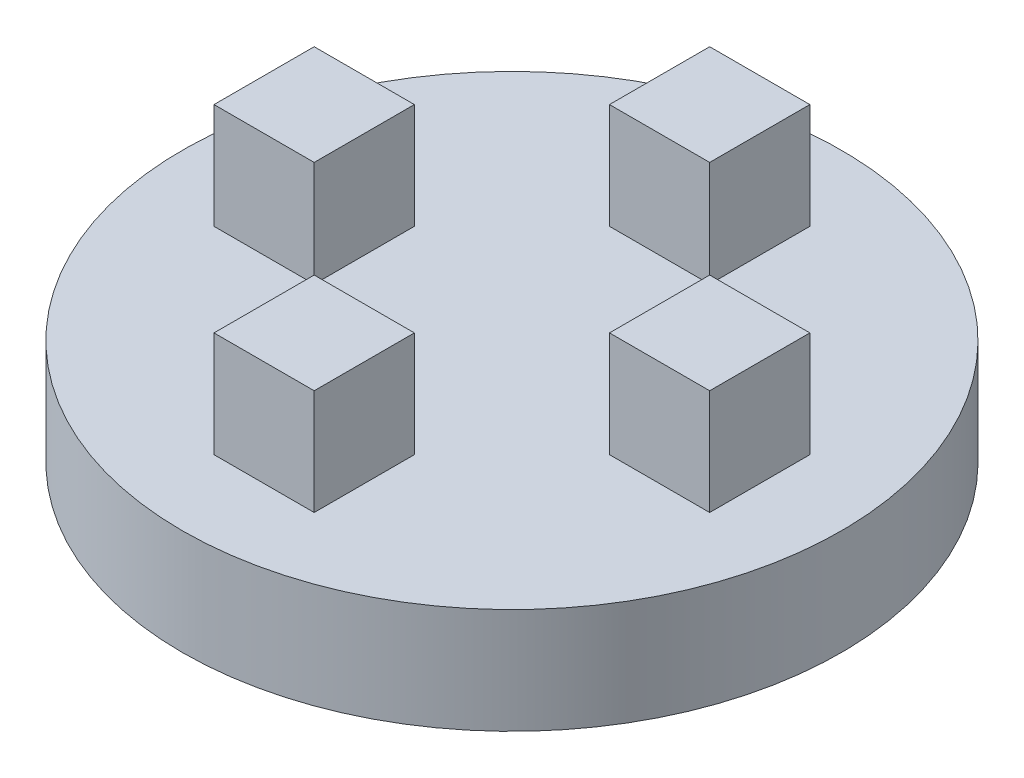
from build123d import *

# Parameters (mm, degrees)
SKETCH1_R           = 12.5
BOSS_EXTRUDE1_DEPTH = 2
SKETCH2_W           = 3.8
SKETCH2_H           = 3.8
BOSS_EXTRUDE3_DEPTH = 4
SKETCH3_R           = 3.5
BOSS_EXTRUDE4_DEPTH = 1
BOSS_EXTRUDE5_DEPTH = 5


with BuildPart() as part:
    # Sketch1 → Boss-Extrude1 (new, symmetric)
    with BuildSketch(Plane(origin=(0, 0, 0), x_dir=(1, 0, 0), z_dir=(0, 1, 0))):
        Circle(SKETCH1_R)
    extrude(amount=BOSS_EXTRUDE1_DEPTH, both=True)

    # Sketch2 → Boss-Extrude3 (add)
    with BuildSketch(Plane(origin=(0, 2, 0), x_dir=(1, 0, 0), z_dir=(0, 1, 0))):
        with Locations((0, 7.5)):
            Rectangle(SKETCH2_W, SKETCH2_H)
        with Locations((7.5, 0)):
            Rectangle(SKETCH2_W, SKETCH2_H)
        with Locations((0, -7.5)):
            Rectangle(SKETCH2_W, SKETCH2_H)
        with Locations((-7.5, 0)):
            Rectangle(SKETCH2_W, SKETCH2_H)
    extrude(amount=BOSS_EXTRUDE3_DEPTH)

    # Sketch3 → Boss-Extrude4 (add)
    with BuildSketch(Plane.XZ.offset(2)):
        Circle(SKETCH3_R)
    extrude(amount=BOSS_EXTRUDE4_DEPTH)

    # Sketch4 → Boss-Extrude5 (add)
    with BuildSketch(Plane.XZ.offset(3)):
        Polygon((0, -2.45), (2.121762239, -1.225), (2.121762239, 1.225), (0, 2.45), (-2.121762239, 1.225), (-2.121762239, -1.225), align=None)
    extrude(amount=BOSS_EXTRUDE5_DEPTH)


solid = part.part
